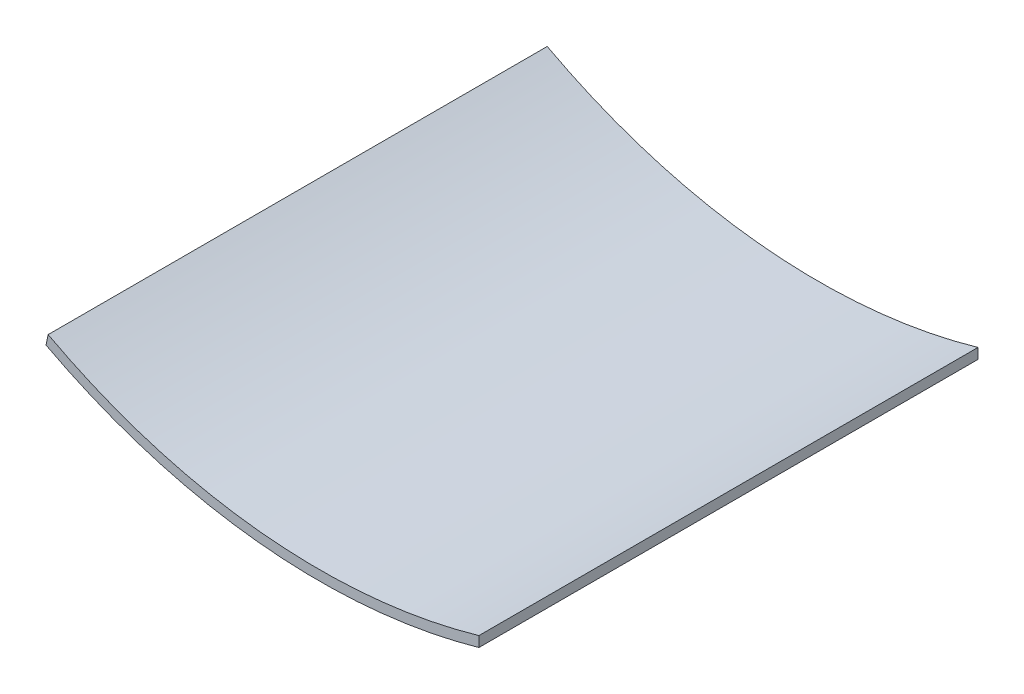
from build123d import *

# Parameters (mm, degrees)
BOSS_EXTRUDE1_DEPTH = 158.75


with BuildPart() as part:
    # Sketch1 → Boss-Extrude1 (new body)
    with BuildSketch(Plane(origin=(0, 0, 0), x_dir=(0, 1, 0), z_dir=(0, 0, 1))):
        with BuildLine():
            Line((-164.512361246, 86.903084078), (-161.2818182, 86.216410956))
            ThreePointArc((-161.2818182, 86.216410956), (-181.878164225, 19.116165362), (-175.682823292, -50.8))
            Line((-175.682823292, -50.8), (-178.985538592, -50.8))
            ThreePointArc((-178.985538592, -50.8), (-185.035771243, 19.448043233), (-164.512361246, 86.903084078))
        make_face()
    extrude(amount=BOSS_EXTRUDE1_DEPTH)


solid = part.part
